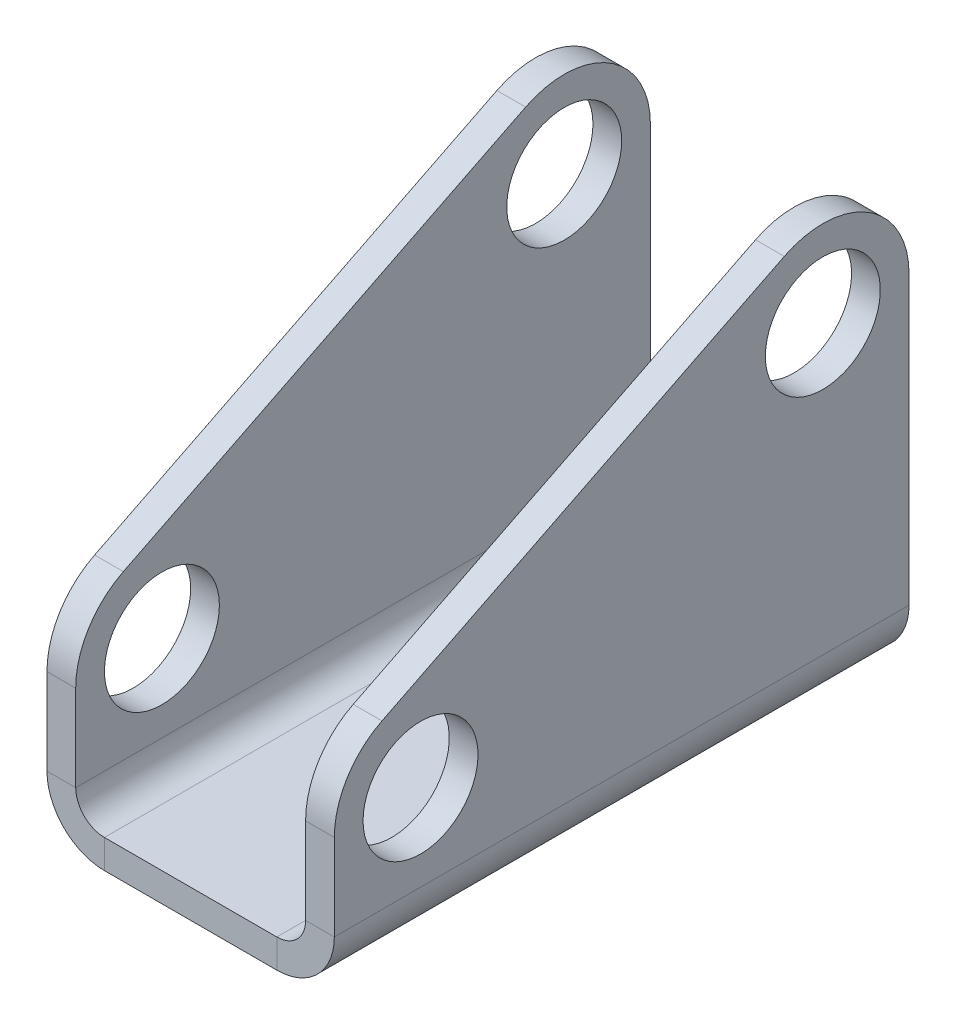
from build123d import *

# Parameters (mm, degrees)
T_LE_DE_BASE_PLI_E1_DEPTH = 20
ESQUISSE7_R               = 2
ENL_V_MAT_EXTRU_1_DEPTH   = 25.586228611
ENL_V_MAT_EXTRU_2_DEPTH   = 25.586228611


# Sheet-metal steps are written as plain solids
with BuildPart() as part:
    # Esquisse2 → Tôle de base pliée1 (new body)
    with BuildSketch(Plane.XY):
        with BuildLine():
            Line((-8.571428571, 10.221674877), (-8.571428571, -2.778325123))
            ThreePointArc((-8.571428571, -2.778325123), (-7.985642134, -4.192538686), (-6.571428571, -4.778325123))
            Line((-6.571428571, -4.778325123), (-0.571428571, -4.778325123))
            ThreePointArc((-0.571428571, -4.778325123), (0.842784991, -4.192538686), (1.428571429, -2.778325123))
            Line((1.428571429, -2.778325123), (1.428571429, 10.221674877))
            Line((1.428571429, 10.221674877), (0.428571429, 10.221674877))
            Line((0.428571429, 10.221674877), (0.428571429, -2.778325123))
            ThreePointArc((0.428571429, -2.778325123), (0.13567821, -3.485431904), (-0.571428571, -3.778325123))
            Line((-0.571428571, -3.778325123), (-6.571428571, -3.778325123))
            ThreePointArc((-6.571428571, -3.778325123), (-7.278535353, -3.485431904), (-7.571428571, -2.778325123))
            Line((-7.571428571, -2.778325123), (-7.571428571, 10.221674877))
            Line((-7.571428571, 10.221674877), (-8.571428571, 10.221674877))
        make_face()
    extrude(amount=T_LE_DE_BASE_PLI_E1_DEPTH)

    # Esquisse7 → Enlèv. mat.-Extru.1 (cut, through all)
    with BuildSketch(Plane(origin=(1.428571429, 0, 0), x_dir=(0, 0, -1), z_dir=(1, 0, 0))):
        with Locations(Location((-3, 7.221674877, 0), (0, 0, 180))):
            Circle(ESQUISSE7_R)
        with Locations((-17, 0.221674877)):
            Circle(ESQUISSE7_R)
        with BuildLine():
            Line((-18.341640786, 2.90495645), (-4.341640786, 9.90495645))
            ThreePointArc((-4.341640786, 9.90495645), (-3.689258762, 10.141421845), (-3, 10.221674877))
            Line((-3, 10.221674877), (-20, 10.221674877))
            Line((-20, 10.221674877), (-20, 0.221674877))
            ThreePointArc((-20, 0.221674877), (-19.551952425, 1.798868213), (-18.341640786, 2.90495645))
        make_face()
    extrude(amount=-ENL_V_MAT_EXTRU_1_DEPTH, mode=Mode.SUBTRACT)

    # Esquisse9 → Enlèv. mat.-Extru.2 (cut, through all)
    with BuildSketch(Plane(origin=(1.428571429, 0, 0), x_dir=(0, 0, -1), z_dir=(1, 0, 0))):
        with BuildLine():
            Line((-3, 10.221674877), (0, 10.221674877))
            Line((0, 10.221674877), (0, 7.221674877))
            ThreePointArc((0, 7.221674877), (-0.878679656, 9.34299522), (-3, 10.221674877))
        make_face()
    extrude(amount=-ENL_V_MAT_EXTRU_2_DEPTH, mode=Mode.SUBTRACT)


solid = part.part
